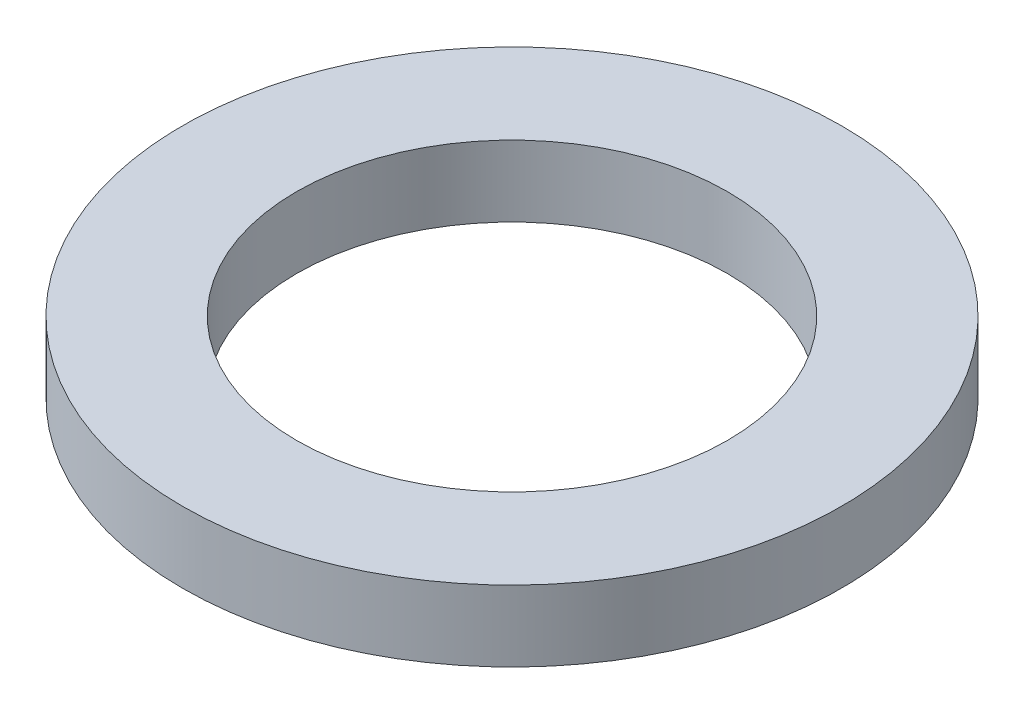
from build123d import *

# Parameters (mm, degrees)
SKETCH1_R           = 65
BOSS_EXTRUDE1_DEPTH = 14
SKETCH2_R           = 42.5
CUT_EXTRUDE1_DEPTH  = 93.983869569


with BuildPart() as part:
    # Sketch1 → Boss-Extrude1 (new body)
    with BuildSketch(Plane(origin=(0, 0, 0), x_dir=(1, 0, 0), z_dir=(0, 1, 0))):
        Circle(SKETCH1_R)
    extrude(amount=BOSS_EXTRUDE1_DEPTH)

    # Sketch2 → Cut-Extrude1 (cut, through all)
    with BuildSketch(Plane(origin=(0, 0, 0), x_dir=(1, 0, 0), z_dir=(0, 1, 0))):
        Circle(SKETCH2_R)
    extrude(amount=CUT_EXTRUDE1_DEPTH, mode=Mode.SUBTRACT)


solid = part.part
